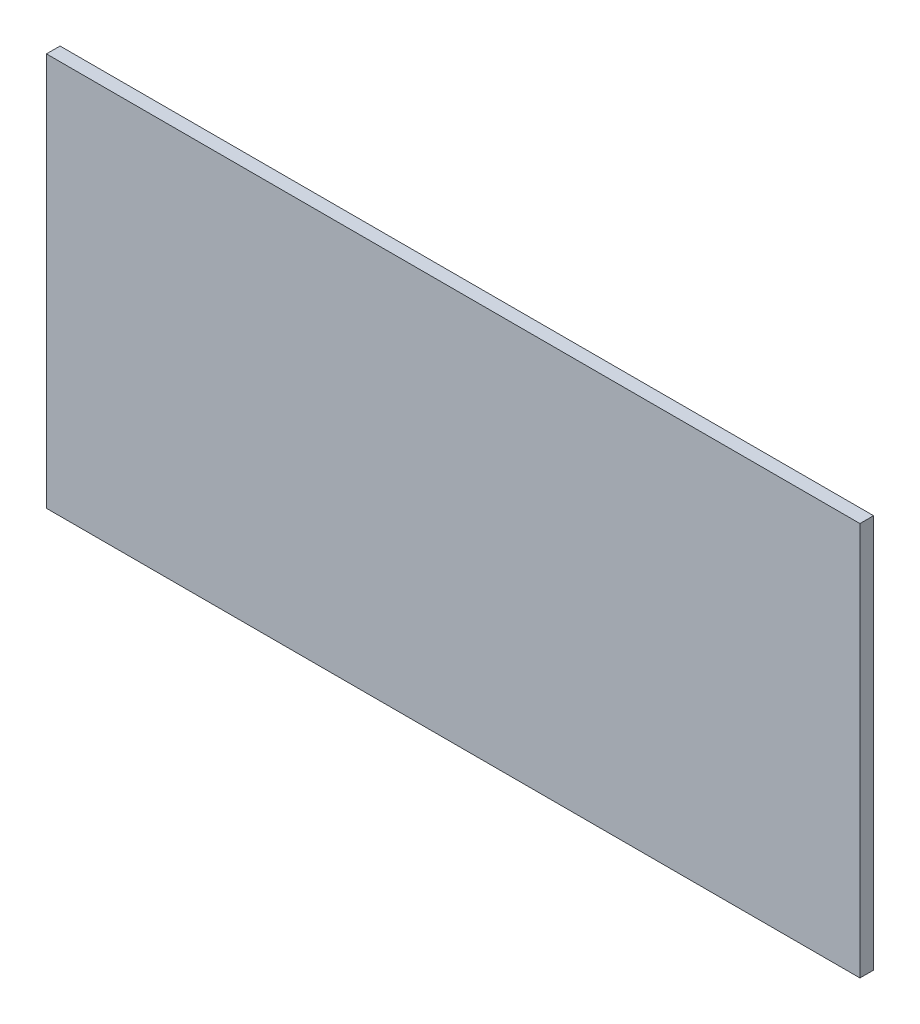
from build123d import *

# Parameters (mm, degrees)
SKETCH8_W          = 179.125109703
SKETCH8_H          = 86.656395254
BASE_FLANGE2_DEPTH = 3


# Sheet-metal steps are written as plain solids
with BuildPart() as part:
    # Sketch8 → Base-Flange2 (new body)
    with BuildSketch(Plane.XY):
        with Locations((-35.666504145, 30.778872095)):
            Rectangle(SKETCH8_W, SKETCH8_H)
    extrude(amount=-BASE_FLANGE2_DEPTH)


solid = part.part
